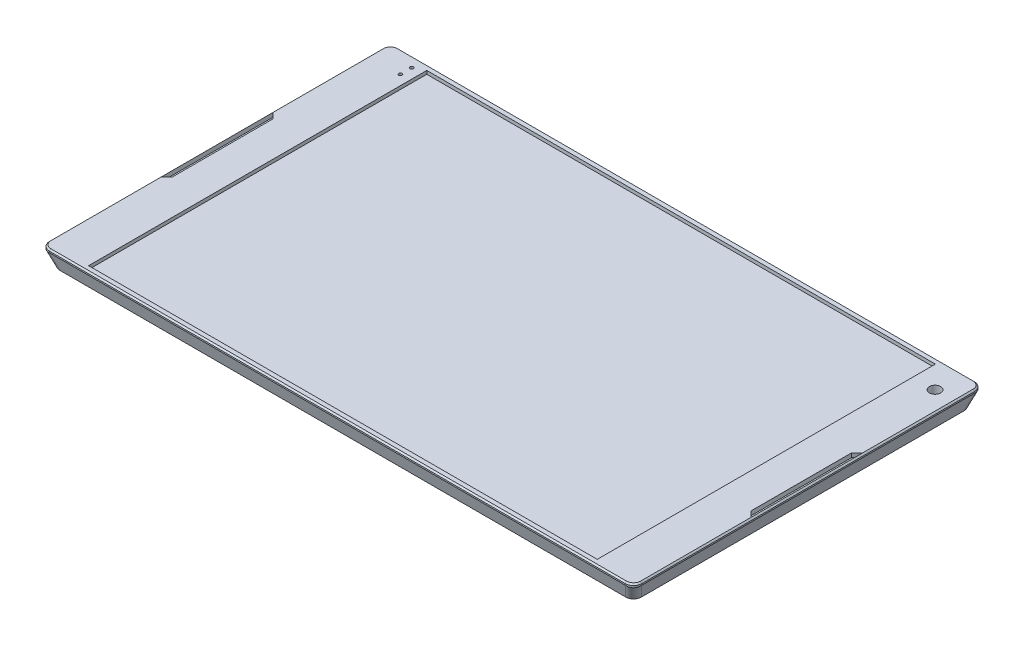
from build123d import *

# Parameters (mm, degrees)
SKETCH1_W           = 212
SKETCH1_H           = 125
BOSS_EXTRUDE1_DEPTH = 6.6
SKETCH2_W           = 182
SKETCH2_H           = 121
CUT_EXTRUDE1_DEPTH  = 1.2
CUT_EXTRUDE2_DEPTH  = 131.2
CUT_EXTRUDE3_DEPTH  = 131.2
CUT_EXTRUDE4_DEPTH  = 221.2
CUT_EXTRUDE5_DEPTH  = 221.2
FILLET1_R           = 3
SKETCH7_R           = 2.5
CUT_EXTRUDE6_DEPTH  = 6
SKETCH8_R           = 3.5
CUT_EXTRUDE7_DEPTH  = 1
SKETCH9_R           = 2
CUT_EXTRUDE8_DEPTH  = 5
SKETCH10_R          = 0.6
CUT_EXTRUDE9_DEPTH  = 1.5
CHAMFER1_SIZE       = 0.5
CUT_EXTRUDE10_DEPTH = 1.5
CUT_EXTRUDE11_DEPTH = 1.5


with BuildPart() as part:
    # Sketch1 → Boss-Extrude1 (new body)
    with BuildSketch(Plane(origin=(0, 0, 0), x_dir=(1, 0, 0), z_dir=(0, 1, 0))):
        with Locations((-26.64556962, -19.170886076)):
            Rectangle(SKETCH1_W, SKETCH1_H)
    extrude(amount=BOSS_EXTRUDE1_DEPTH)

    # Sketch2 → Cut-Extrude1 (cut)
    with BuildSketch(Plane(origin=(0, 6.6, 0), x_dir=(1, 0, 0), z_dir=(0, 1, 0))):
        with Locations((-26.64556962, -19.170886076)):
            Rectangle(SKETCH2_W, SKETCH2_H)
    extrude(amount=-CUT_EXTRUDE1_DEPTH, mode=Mode.SUBTRACT)

    # Sketch3 → Cut-Extrude2 (cut)
    with BuildSketch(Plane.XY.offset(81.670886076)):
        Polygon((-132.64556962, 5.6), (-130.64556962, 0), (-132.64556962, 0), align=None)
    extrude(amount=-CUT_EXTRUDE2_DEPTH, mode=Mode.SUBTRACT)

    # Sketch4 → Cut-Extrude3 (cut)
    with BuildSketch(Plane.XY.offset(81.670886076)):
        Polygon((79.35443038, 5.6), (77.35443038, 0), (79.35443038, 0), align=None)
    extrude(amount=-CUT_EXTRUDE3_DEPTH, mode=Mode.SUBTRACT)

    # Sketch5 → Cut-Extrude4 (cut)
    with BuildSketch(Plane(origin=(79.35443038, 0, 0), x_dir=(0, 0, -1), z_dir=(1, 0, 0))):
        Polygon((-81.670886076, 5.6), (-79.670886076, 0), (-81.670886076, 0), align=None)
    extrude(amount=-CUT_EXTRUDE4_DEPTH, mode=Mode.SUBTRACT)

    # Sketch6 → Cut-Extrude5 (cut)
    with BuildSketch(Plane(origin=(79.35443038, 0, 0), x_dir=(0, 0, -1), z_dir=(1, 0, 0))):
        Polygon((43.329113924, 5.6), (41.329113924, 0), (43.329113924, 0), align=None)
    extrude(amount=-CUT_EXTRUDE5_DEPTH, mode=Mode.SUBTRACT)

    # Fillet1
    # the kernel refuses this fillet: 3 mm, written as the material it takes off along each edge
    with BuildSketch(Plane(origin=(75.220284038, -5.975609756, 77.536739734), x_dir=(0.1072201272408216, 0.30021635627431204, -0.9478259248088952), z_dir=(0.3187883565316692, 0.8926073982886735, 0.31878835653166915)), Plane(origin=(75.220284038, -5.975609756, -39.194967583), x_dir=(-0.9478259248088952, 0.30021635627431126, -0.10722012724082396), z_dir=(0.31878835653166926, 0.892607398288674, -0.3187883565316682))) as fillet1_piece_1:
        with BuildLine():
            CenterArc((FILLET1_R * 0.892607398289, FILLET1_R), FILLET1_R, 186.495326626, 83.504673374)
            Line((-FILLET1_R * 0.100973687589, FILLET1_R * 0.886877828054), (0, 0))
            Line((0, 0), (FILLET1_R * 0.892607398289, 0))
        make_face()
    extrude(amount=19.662865831, mode=Mode.SUBTRACT)
    with BuildSketch(Plane(origin=(-128.511423279, -5.975609756, 77.536739734), x_dir=(-0.10722012724082589, 0.30021635627431054, -0.947825924808895), z_dir=(-0.3187883565316692, 0.8926073982886735, 0.31878835653166926)), Plane(origin=(-128.511423279, -5.975609756, -39.194967583), x_dir=(0.9478259248088952, 0.30021635627431037, -0.10722012724082654), z_dir=(-0.31878835653166926, 0.892607398288674, -0.3187883565316681))) as fillet1_piece_2:
        with BuildLine():
            CenterArc((FILLET1_R * 0.892607398289, -FILLET1_R), FILLET1_R, 90, 83.504673374)
            Line((-FILLET1_R * 0.100973687589, -FILLET1_R * 0.886877828054), (0, 0))
            Line((0, 0), (FILLET1_R * 0.892607398289, 0))
        make_face()
    extrude(amount=19.662865831, mode=Mode.SUBTRACT)
    with BuildSketch(Plane(origin=(-132.64556962, -1.9, -43.329113924), x_dir=(1, 0, 0), z_dir=(0, 1, 0)), Plane(origin=(-132.64556962, -1.9, 81.670886076), x_dir=(0, 0, -1), z_dir=(0, 1, 0))) as fillet1_piece_3:
        with BuildLine():
            CenterArc((FILLET1_R, -FILLET1_R), FILLET1_R, 90, 90)
            Line((0, -FILLET1_R), (0, 0))
            Line((0, 0), (FILLET1_R, 0))
        make_face()
    extrude(amount=16, mode=Mode.SUBTRACT)
    with BuildSketch(Plane(origin=(79.35443038, -1.9, -43.329113924), x_dir=(-1, 0, 0), z_dir=(0, 1, 0)), Plane(origin=(79.35443038, -1.9, 81.670886076), x_dir=(0, 0, -1), z_dir=(0, 1, 0))) as fillet1_piece_4:
        with BuildLine():
            CenterArc((FILLET1_R, FILLET1_R), FILLET1_R, 180, 90)
            Line((0, FILLET1_R), (0, 0))
            Line((0, 0), (FILLET1_R, 0))
        make_face()
    extrude(amount=16, mode=Mode.SUBTRACT)

    # Sketch7 → Cut-Extrude6 (cut)
    with BuildSketch(Plane.XZ):
        with Locations(Location((-125.64556962, -36.329113924, 0), (0, 0, 270))):
            Circle(SKETCH7_R)
    extrude(amount=-CUT_EXTRUDE6_DEPTH, mode=Mode.SUBTRACT)

    # Sketch8 → Cut-Extrude7 (cut)
    with BuildSketch(Plane.XZ):
        with Locations(Location((-125.64556962, -36.329113924, 0), (0, 0, 270))):
            Circle(SKETCH8_R)
    extrude(amount=-CUT_EXTRUDE7_DEPTH, mode=Mode.SUBTRACT)

    # Sketch9 → Cut-Extrude8 (cut)
    with BuildSketch(Plane(origin=(0, 6.6, 0), x_dir=(1, 0, 0), z_dir=(0, 1, 0))):
        with Locations(Location((72.241534247, 33.329113924, 0), (0, 0, 270))):
            Circle(SKETCH9_R)
    extrude(amount=-CUT_EXTRUDE8_DEPTH, mode=Mode.SUBTRACT)

    # Sketch10 → Cut-Extrude9 (cut)
    with BuildSketch(Plane(origin=(0, 6.6, 0), x_dir=(1, 0, 0), z_dir=(0, 1, 0))):
        with Locations(Location((-121.14556962, 39.465683386, 0), (0, 0, 270))):
            Circle(SKETCH10_R)
        with Locations(Location((-121.157311089, 35.420585215, 0), (0, 0, 270))):
            Circle(SKETCH10_R)
    extrude(amount=-CUT_EXTRUDE9_DEPTH, mode=Mode.SUBTRACT)

    # Chamfer1
    chamfer1_edges = [part.edges().sort_by_distance(p)[0] for p in [
        (-132.64556962, 6.6, 19.170886076),
        (-26.64556962, 6.6, -43.329113924),
        (-26.64556962, 6.6, 81.670886076),
        (79.35443038, 6.6, 19.170886076),
        (78.475750723, 6.6, -42.450434268),
        (78.475750723, 6.6, 80.79220642),
        (-131.766889964, 6.6, 80.79220642),
        (-131.766889964, 6.6, -42.450434268),
    ]]
    chamfer(chamfer1_edges, length=CHAMFER1_SIZE)

    # Sketch11 → Cut-Extrude10 (cut)
    with BuildSketch(Plane(origin=(0, 6.6, 0), x_dir=(1, 0, 0), z_dir=(0, 1, 0))):
        Polygon((-132.14556962, -19.170886076), (-132.14556962, -39.170886076), (-130.14556962, -37.170886076), (-130.14556962, -1.170886076), (-132.14556962, 0.829113924), align=None)
    extrude(amount=-CUT_EXTRUDE10_DEPTH, mode=Mode.SUBTRACT)

    # Sketch12 → Cut-Extrude11 (cut)
    with BuildSketch(Plane(origin=(0, 6.6, 0), x_dir=(1, 0, 0), z_dir=(0, 1, 0))):
        Polygon((78.85443038, -19.170886076), (78.85443038, 0.829113924), (76.85443038, -1.170886076), (76.85443038, -37.170886076), (78.85443038, -39.170886076), align=None)
    extrude(amount=-CUT_EXTRUDE11_DEPTH, mode=Mode.SUBTRACT)


solid = part.part
